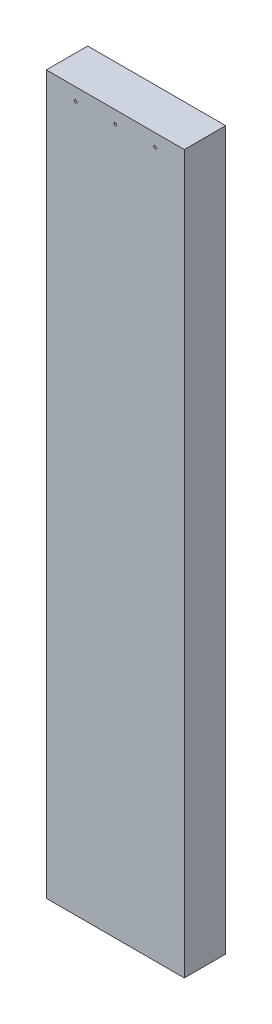
from build123d import *

# Parameters (mm, degrees)
SKETCH1_W           = 63.5
SKETCH1_H           = 19.05
BOSS_EXTRUDE1_DEPTH = 330.2
SKETCH2_R           = 0.635
CUT_EXTRUDE1_DEPTH  = 337.789537397


with BuildPart() as part:
    # Sketch1 → Boss-Extrude1 (new body)
    with BuildSketch(Plane(origin=(0, 0, 0), x_dir=(1, 0, 0), z_dir=(0, 1, 0))):
        with Locations((31.75, 9.525)):
            Rectangle(SKETCH1_W, SKETCH1_H)
    extrude(amount=BOSS_EXTRUDE1_DEPTH)

    # Sketch2 → Cut-Extrude1 (cut, through all)
    with BuildSketch(Plane.XY):
        with Locations((13.462, 324.358)):
            Circle(SKETCH2_R)
        with Locations((31.75, 324.358)):
            Circle(SKETCH2_R)
        with Locations((50.038, 324.358)):
            Circle(SKETCH2_R)
    extrude(amount=-CUT_EXTRUDE1_DEPTH, mode=Mode.SUBTRACT)


solid = part.part
